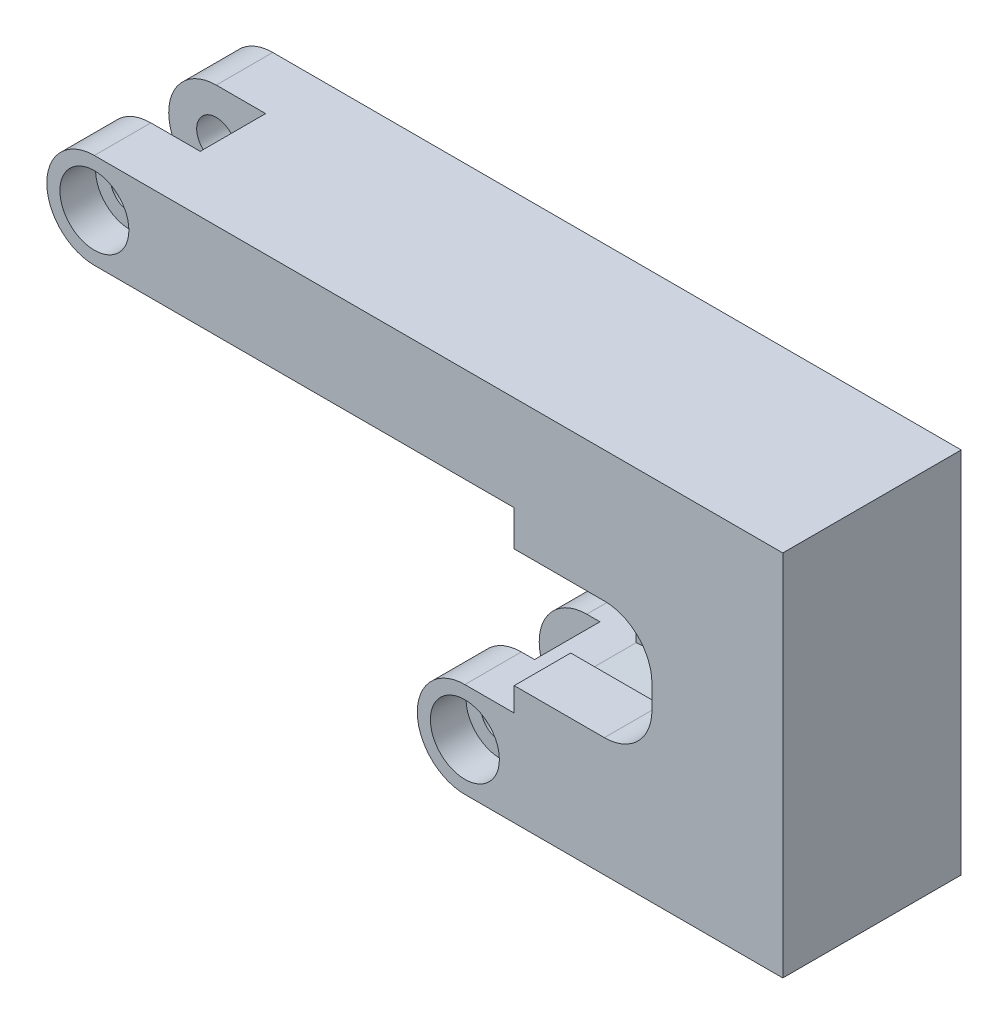
from build123d import *

# Parameters (mm, degrees)
BOSS_EXTRUDE1_DEPTH      = 4.75
BOSS_EXTRUDE1_DEPTH_BACK = 4.75
SKETCH1_R                = 1.65
BOSS_EXTRUDE3_START      = -7.5
BOSS_EXTRUDE3_OUTLINE_R  = 1.65
BOSS_EXTRUDE3_DEPTH      = 15
CUT_EXTRUDE1_START       = -2.75
CUT_EXTRUDE1_OUTLINE_R   = 1.65
CUT_EXTRUDE1_DEPTH       = 5.5
CUT_EXTRUDE2_REACH       = 117.308
SKETCH3_W                = 5.5
SKETCH3_H                = 14
FILLET1_R                = 4
CUT_EXTRUDE3_START       = 7.5
SKETCH4_R                = 2.9
CUT_EXTRUDE3_DEPTH       = 3
CUT_EXTRUDE4_START       = -5.3
SKETCH4_4_R              = 2.9
CUT_EXTRUDE4_DEPTH       = 2.2


# Read off the part's stored shape, not the designer's step: Boss-Extrude3, Cut-Extrude1
with BuildPart() as part:
    # Sketch1 → Boss-Extrude1 (new, two sides: drawn at the far end of the back side and taken through both)
    with BuildSketch(Plane.XY.offset(-BOSS_EXTRUDE1_DEPTH_BACK)):
        with BuildLine():
            ThreePointArc((0, 4), (-4, 0), (0, -4))
            Line((0, -4), (26.73, -4))
            Line((26.73, -4), (26.73, 26.95))
            Line((26.73, 26.95), (-31.15, 26.95))
            ThreePointArc((-31.15, 26.95), (-35.15, 22.95), (-31.15, 18.95))
            Line((-31.15, 18.95), (4.15, 18.95))
            Line((4.15, 18.95), (4.15, 15.95))
            Line((4.15, 15.95), (15.73, 15.95))
            Line((15.73, 15.95), (15.73, 6))
            Line((15.73, 6), (4.15, 6))
            Line((4.15, 6), (4.15, 4))
            Line((4.15, 4), (0, 4))
        make_face()
        Circle(SKETCH1_R, mode=Mode.SUBTRACT)
        Polygon((-27.685898385, 22.95), (-29.417949192, 19.95), (-32.882050808, 19.95), (-34.614101615, 22.95), (-32.882050808, 25.95), (-29.417949192, 25.95), align=None, mode=Mode.SUBTRACT)
    extrude(amount=BOSS_EXTRUDE1_DEPTH + BOSS_EXTRUDE1_DEPTH_BACK)

    # Boss-Extrude3 outline → Boss-Extrude3 (add)
    with BuildSketch(Plane.XY.offset(BOSS_EXTRUDE3_START)):
        with BuildLine():
            Line((4.15, 4), (0, 4))
            ThreePointArc((0, 4), (-4, 0), (0, -4))
            Line((0, -4), (26.73, -4))
            Line((26.73, -4), (26.73, 26.95))
            Line((26.73, 26.95), (-31.15, 26.95))
            ThreePointArc((-31.15, 26.95), (-35.15, 22.95), (-31.15, 18.95))
            Line((-31.15, 18.95), (4.15, 18.95))
            Line((4.15, 18.95), (4.15, 15.95))
            Line((4.15, 15.95), (15.73, 15.95))
            Line((15.73, 15.95), (15.73, 6))
            Line((15.73, 6), (4.15, 6))
            Line((4.15, 6), (4.15, 4))
        make_face()
        Circle(BOSS_EXTRUDE3_OUTLINE_R, mode=Mode.SUBTRACT)
        with Locations((-31.15, 22.95)):
            Circle(BOSS_EXTRUDE3_OUTLINE_R, mode=Mode.SUBTRACT)
    extrude(amount=BOSS_EXTRUDE3_DEPTH)

    # Cut-Extrude1 outline → Cut-Extrude1 (cut)
    # profile 1 of 2: a face of its own
    with BuildSketch(Plane.XY.offset(CUT_EXTRUDE1_START)):
        with BuildLine():
            Line((0, -4), (4.15, -4))
            Line((4.15, -4), (4.15, 0))
            ThreePointArc((4.15, 0), (3.302349085, 2.513362393), (1.105667219, 4))
            Line((1.105667219, 4), (0, 4))
            ThreePointArc((0, 4), (-4, 0), (0, -4))
        make_face()
        Circle(CUT_EXTRUDE1_OUTLINE_R, mode=Mode.SUBTRACT)
    # profile 2 of 2: a face of its own
    with BuildSketch(Plane.XY.offset(CUT_EXTRUDE1_START)):
        with BuildLine():
            Line((-27, 18.95), (-27, 26.95))
            Line((-27, 26.95), (-31.15, 26.95))
            ThreePointArc((-31.15, 26.95), (-35.15, 22.95), (-31.15, 18.95))
            Line((-31.15, 18.95), (-27, 18.95))
        make_face()
        with Locations((-31.15, 22.95)):
            Circle(CUT_EXTRUDE1_OUTLINE_R, mode=Mode.SUBTRACT)
    extrude(amount=CUT_EXTRUDE1_DEPTH, mode=Mode.SUBTRACT)

    # Cut-Extrude2: up to this plane
    cut_extrude2_end = Plane(origin=(17.73, 0, -4.75), z_dir=(-1, 0, 0))
    # Sketch3 → Cut-Extrude2 (cut, up to the surface)
    with BuildSketch(Plane(origin=(-4.830790631, 106.650906635, 0), x_dir=(0, 0, -1), z_dir=(-0.9961946980917455, -0.08715574274765839, 0)), mode=Mode.PRIVATE) as cut_extrude2_sk1:
        with Locations((0, 96.043016422)):
            Rectangle(SKETCH3_W, SKETCH3_H)
    cut_extrude2_tool1 = split(extrude(cut_extrude2_sk1.sketch, amount=-CUT_EXTRUDE2_REACH, mode=Mode.PRIVATE), bisect_by=cut_extrude2_end, keep=Keep.BOTH, mode=Mode.PRIVATE)
    add(cut_extrude2_tool1.solids().sort_by_distance((3.53991, 10.973363, 0))[0], mode=Mode.SUBTRACT)

    # Fillet1
    fillet1_edges = [part.edges().sort_by_distance(p)[0] for p in [
        (15.73, 6, 5.125),
        (15.73, 15.95, 5.125),
        (15.73, 6, -5.125),
        (15.73, 15.95, -5.125),
    ]]
    fillet(fillet1_edges, radius=FILLET1_R)

    # Sketch4 → Cut-Extrude3 (cut)
    with BuildSketch(Plane.XY.offset(CUT_EXTRUDE3_START)):
        with Locations((-31.15, 22.95)):
            Circle(SKETCH4_R)
        Circle(SKETCH4_R)
    extrude(amount=-CUT_EXTRUDE3_DEPTH, mode=Mode.SUBTRACT)

    # Sketch4<4> → Cut-Extrude4 (cut)
    with BuildSketch(Plane.XY.offset(CUT_EXTRUDE4_START)):
        Circle(SKETCH4_4_R)
        with BuildLine():
            Line((-1.674315781, -2.9), (0, -2.9))
            ThreePointArc((0, -2.9), (-1.450000053, -2.511473641), (-2.511473732, -1.449999895))
            Line((-2.511473732, -1.449999895), (-1.674315781, -2.9))
        make_face()
        with BuildLine():
            ThreePointArc((-2.511473732, -1.449999895), (-2.9, 9e-09), (-2.511473723, 1.44999991))
            Line((-2.511473723, 1.44999991), (-3.348631561, 0))
            Line((-3.348631561, 0), (-2.511473732, -1.449999895))
        make_face()
        with BuildLine():
            ThreePointArc((-2.511473723, 1.44999991), (-1.45000005, 2.511473642), (-1.2e-08, 2.9))
            Line((-1.2e-08, 2.9), (-1.674315781, 2.9))
            Line((-1.674315781, 2.9), (-2.511473723, 1.44999991))
        make_face()
        with BuildLine():
            ThreePointArc((-1.2e-08, 2.9), (1.449999995, 2.511473674), (2.511473671, 1.45))
            Line((2.511473671, 1.45), (1.674315781, 2.9))
            Line((1.674315781, 2.9), (-1.2e-08, 2.9))
        make_face()
        with BuildLine():
            Line((2.511473679, -1.449999986), (3.348631561, 0))
            Line((3.348631561, 0), (2.511473671, 1.45))
            ThreePointArc((2.511473671, 1.45), (2.801184896, 0.750575231), (2.9, 0))
            ThreePointArc((2.9, 0), (2.801184898, -0.750575223), (2.511473679, -1.449999986))
        make_face()
        with BuildLine():
            Line((1.674315781, -2.9), (2.511473679, -1.449999986))
            ThreePointArc((2.511473679, -1.449999986), (1.450000007, -2.511473667), (0, -2.9))
            Line((0, -2.9), (1.674315781, -2.9))
        make_face()
        with Locations((-31.15, 22.95)):
            Circle(SKETCH4_4_R)
        with BuildLine():
            Line((-29.475684219, 20.05), (-28.638526291, 21.500000065))
            ThreePointArc((-28.638526291, 21.500000065), (-29.699999968, 20.438526348), (-31.15, 20.05))
            Line((-31.15, 20.05), (-29.475684219, 20.05))
        make_face()
        with BuildLine():
            Line((-28.638526291, 21.500000065), (-27.801368439, 22.95))
            Line((-27.801368439, 22.95), (-28.638526352, 24.40000004))
            ThreePointArc((-28.638526352, 24.40000004), (-28.34881511, 23.700575253), (-28.25, 22.95))
            ThreePointArc((-28.25, 22.95), (-28.348815094, 22.199424805), (-28.638526291, 21.500000065))
        make_face()
        with BuildLine():
            ThreePointArc((-31.150000038, 25.85), (-29.700000036, 25.461473692), (-28.638526352, 24.40000004))
            Line((-28.638526352, 24.40000004), (-29.475684219, 25.85))
            Line((-29.475684219, 25.85), (-31.150000038, 25.85))
        make_face()
        with BuildLine():
            ThreePointArc((-33.661473709, 24.399999935), (-32.600000049, 25.461473643), (-31.150000038, 25.85))
            Line((-31.150000038, 25.85), (-32.824315781, 25.85))
            Line((-32.824315781, 25.85), (-33.661473709, 24.399999935))
        make_face()
        with BuildLine():
            ThreePointArc((-33.661473549, 21.499999789), (-34.05, 22.949999841), (-33.661473709, 24.399999935))
            Line((-33.661473709, 24.399999935), (-34.498631561, 22.95))
            Line((-34.498631561, 22.95), (-33.661473549, 21.499999789))
        make_face()
        with BuildLine():
            Line((-32.824315781, 20.05), (-31.15, 20.05))
            ThreePointArc((-31.15, 20.05), (-32.599999895, 20.438526268), (-33.661473549, 21.499999789))
            Line((-33.661473549, 21.499999789), (-32.824315781, 20.05))
        make_face()
    extrude(amount=-CUT_EXTRUDE4_DEPTH, mode=Mode.SUBTRACT)


solid = part.part
